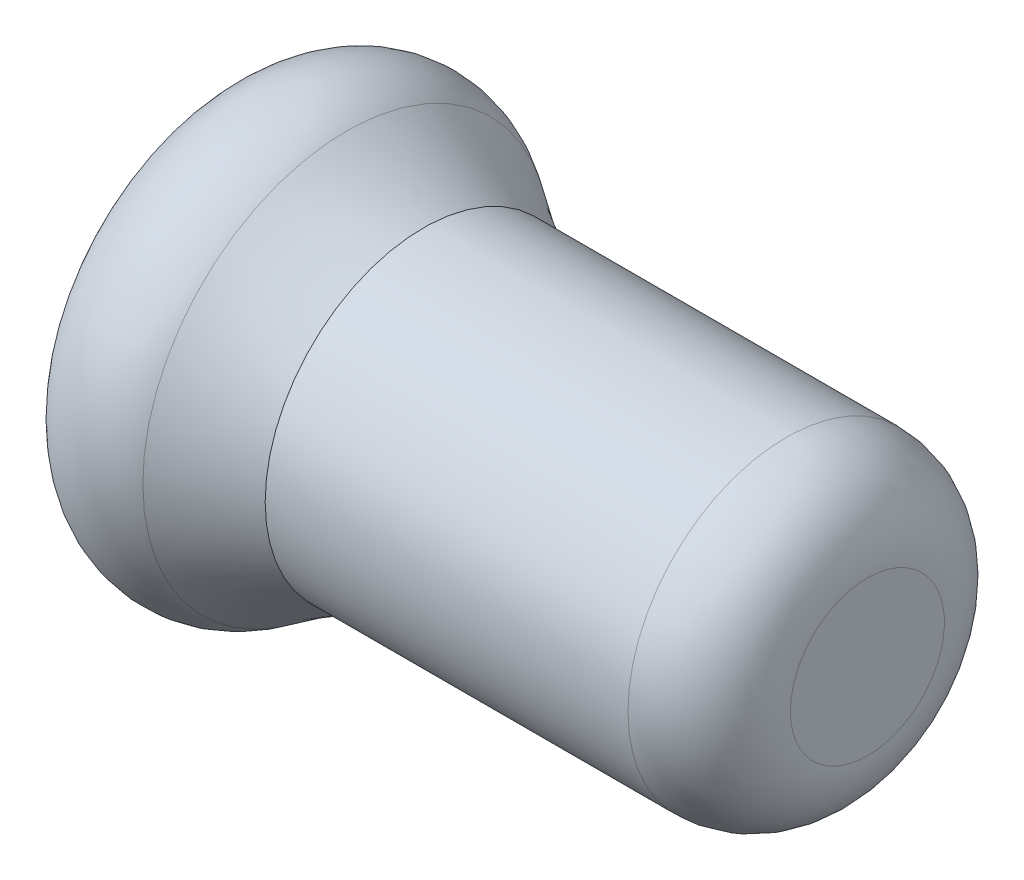
from build123d import *


with BuildPart() as part:
    # Sketch1 → Revolve1 (revolve)
    with BuildSketch(Plane.XY):
        with BuildLine():
            Line((26.680645161, 2), (26.680645161, 0))
            Line((26.680645161, 0), (21.680645161, 0))
            Line((21.680645161, 0), (21.680645161, 2))
            Line((21.680645161, 2), (-13.319354839, 2))
            Line((-13.319354839, 2), (-13.319354839, 8.5))
            ThreePointArc((-13.319354839, 8.5), (-10.590985253, 12.954177282), (-5.383476734, 12.547297834))
            ThreePointArc((-5.383476734, 12.547297834), (-3.084370729, 11.035442519), (-0.656411636, 9.740602932))
            Line((-0.656411636, 9.740602932), (21.680645161, 9.740602932))
            ThreePointArc((21.680645161, 9.740602932), (25.216179067, 8.276136838), (26.680645161, 4.740602932))
            Line((26.680645161, 4.740602932), (26.680645161, 2))
        make_face()
    revolve(axis=Axis((-16.009165471, 0, 0), (1, 0, 0)))


solid = part.part
